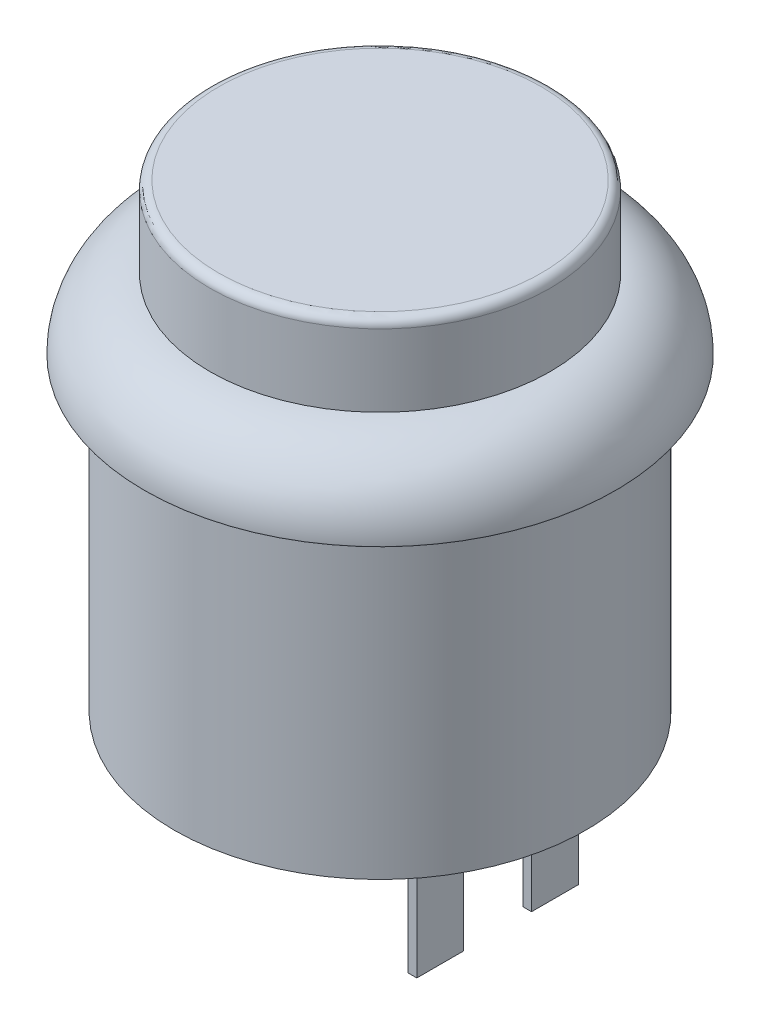
from build123d import *

# Parameters (mm, degrees)
SKETCH1_R           = 11.735
BOSS_EXTRUDE1_DEPTH = 17.64
SKETCH2_R           = 13.44
BOSS_EXTRUDE2_DEPTH = 4
SKETCH3_R           = 9.705
BOSS_EXTRUDE3_DEPTH = 4.62
FILLET1_R           = 4
FILLET2_R           = 0.5
SKETCH4_W           = 0.5
SKETCH4_H           = 2.67
BOSS_EXTRUDE4_DEPTH = 7.51


with BuildPart() as part:
    # Sketch1 → Boss-Extrude1 (new body)
    with BuildSketch(Plane(origin=(0, 0, 0), x_dir=(1, 0, 0), z_dir=(0, 1, 0))):
        with Locations(Location((0, 0, 0), (0, 0, 270))):
            Circle(SKETCH1_R)
    extrude(amount=BOSS_EXTRUDE1_DEPTH)

    # Sketch2 → Boss-Extrude2 (add)
    with BuildSketch(Plane(origin=(0, 17.64, 0), x_dir=(1, 0, 0), z_dir=(0, 1, 0))):
        with Locations(Location((0, 0, 0), (0, 0, 270))):
            Circle(SKETCH2_R)
    extrude(amount=BOSS_EXTRUDE2_DEPTH)

    # Sketch3 → Boss-Extrude3 (add)
    with BuildSketch(Plane(origin=(0, 21.64, 0), x_dir=(1, 0, 0), z_dir=(0, 1, 0))):
        with Locations(Location((0, 0, 0), (0, 0, 270))):
            Circle(SKETCH3_R)
    extrude(amount=BOSS_EXTRUDE3_DEPTH)

    # Fillet1
    # the kernel refuses this fillet: 4 mm, written as the material it takes off along each edge
    with BuildSketch(Plane(origin=(0, 21.64, 0), x_dir=(0, 0, 1), z_dir=(-1, 0, 0))) as fillet1_piece_1:
        with BuildLine():
            CenterArc((9.44, -3.991212222), FILLET1_R, 0, 86.201372408)
            Line((9.705, 0), (9.7103, 0.079824244))
            ThreePointArc((9.7103, 0.079824244), (11.5725, 0.08), (13.44, 0.08))
            Line((13.44, 0.08), (13.52, 0))
            Line((13.52, 0), (13.52, -3.991212222))
            Line((13.52, -3.991212222), (13.44, -3.991212222))
        make_face()
    revolve(axis=Axis((0, 21.64, 0), (0, 1, 0)), mode=Mode.SUBTRACT)

    # Fillet2
    fillet2_edges = [part.edges().sort_by_distance(p)[0] for p in [
        (0, 26.26, -9.705),
    ]]
    fillet(fillet2_edges, radius=FILLET2_R)

    # Sketch4 → Boss-Extrude4 (add)
    with BuildSketch(Plane.XZ):
        with Locations((6.45, 3.27)):
            Rectangle(SKETCH4_W, SKETCH4_H)
        with Locations((6.45, -3.275)):
            Rectangle(SKETCH4_W, SKETCH4_H)
    extrude(amount=BOSS_EXTRUDE4_DEPTH)


solid = part.part
